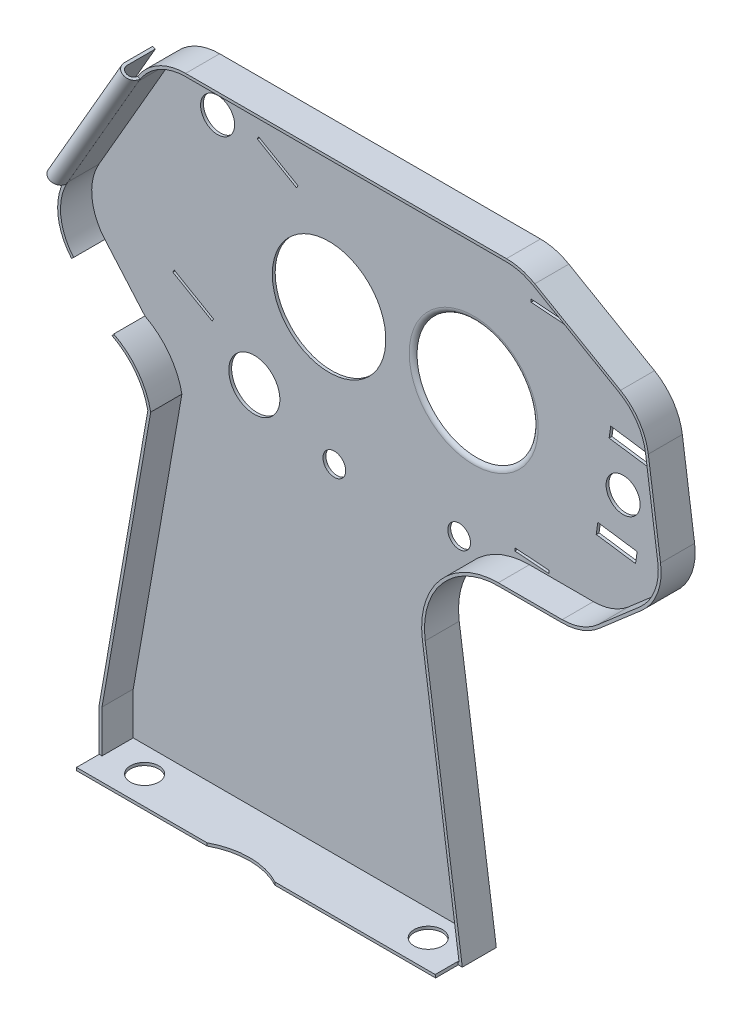
from build123d import *

# Parameters (mm, degrees)
BOSS_EXTRUDE1_DEPTH         = 5
SHELL1_T                    = -0.5
SKETCH4_R                   = 2.5
CUT_EXTRUDE4_DEPTH          = 10
CUT_SWEEP2_START            = 1
CUT_SWEEP2_DEPTH            = 4
SKETCH8_W                   = 6
SKETCH8_H                   = 10.878336181
CUT_EXTRUDE6_DEPTH          = 10
SKETCH11_R                  = 4.5
SKETCH11_R_2                = 10.5
SKETCH11_R_3                = 10
CUT_EXTRUDE7_DEPTH          = 150.877510373
FILLET1_R                   = 1
BOSS_EXTRUDE6_START         = 69.993050043
BOSS_EXTRUDE6_DEPTH         = 26.446393474
BOSS_EXTRUDE6_START_2       = -40
BOSS_EXTRUDE6_2_OUTLINE_W   = 1.69894254
BOSS_EXTRUDE6_2_OUTLINE_H   = 3
BOSS_EXTRUDE6_2_OUTLINE_W_2 = 1.590498846
BOSS_EXTRUDE6_2_OUTLINE_H_2 = 10
BOSS_EXTRUDE6_2_DEPTH       = 7.043773978
BOSS_EXTRUDE6_3_OUTLINE_W   = 1.69894254
BOSS_EXTRUDE6_3_OUTLINE_H   = 7
BOSS_EXTRUDE6_3_DEPTH       = 3.122658049
BOSS_EXTRUDE6_START_3       = -33.015543653
BOSS_EXTRUDE6_4_OUTLINE_W   = 1.590498846
BOSS_EXTRUDE6_4_OUTLINE_H   = 3
BOSS_EXTRUDE6_4_DEPTH       = 2.015543653
SKETCH17_R                  = 3
CUT_EXTRUDE8_DEPTH          = 10
CUT_EXTRUDE9_DEPTH          = 10
SKETCH19_R                  = 2
CUT_EXTRUDE10_DEPTH         = 150.877510373
CUT_EXTRUDE11_DEPTH         = 10


with BuildPart() as part:
    # Sketch1 → Boss-Extrude1 (new, symmetric)
    with BuildSketch(Plane.XY):
        with BuildLine():
            Line((0, 0), (64, 0))
            Line((64, 0), (57.458864255, 46.542599231))
            ThreePointArc((57.458864255, 46.542599231), (60.521124606, 56.88061692), (70.332349149, 61.351849543))
            Line((70.332349149, 61.351849543), (81.602015886, 61.351849543))
            ThreePointArc((81.602015886, 61.351849543), (85.0970904, 61.9825137), (88.15132127, 63.794958715))
            Line((88.15132127, 63.794958715), (95.587384775, 70.239547086))
            ThreePointArc((95.587384775, 70.239547086), (98.399557697, 74.280371374), (98.942828678, 79.173369852))
            Line((98.942828678, 79.173369852), (96.783267224, 94.707844854))
            ThreePointArc((96.783267224, 94.707844854), (95.173069343, 98.916646259), (91.878517937, 101.991166954))
            Line((91.878517937, 101.991166954), (76.780291664, 110.708131957))
            ThreePointArc((76.780291664, 110.708131957), (74.368482115, 111.707136182), (71.780291664, 112.047877919))
            Line((71.780291664, 112.047877919), (15.23328628, 112.047877919))
            ThreePointArc((15.23328628, 112.047877919), (10.23328628, 110.708131957), (6.573032242, 107.047877919))
            Line((6.573032242, 107.047877919), (-5.979384502, 85.30645436))
            ThreePointArc((-5.979384502, 85.30645436), (-7.273805779, 79.355434178), (-4.876021292, 73.757148976))
            Line((-4.876021292, 73.757148976), (2.24853328, 65.536509085))
            ThreePointArc((2.24853328, 65.536509085), (6.355355668, 62.120008219), (8.572429973, 57.259653311))
            Line((8.572429973, 57.259653311), (0, 8))
            Line((0, 8), (0, 0))
        make_face()
    extrude(amount=BOSS_EXTRUDE1_DEPTH, both=True)

    # Shell1
    shell1_openings = [part.faces().sort_by_distance(p)[0] for p in [
        (40.493150865, 62.038987827, 5),
    ]]
    offset(amount=SHELL1_T, openings=shell1_openings, kind=Kind.INTERSECTION)

    # Sketch4 → Cut-Extrude4 (cut)
    with BuildSketch(Plane.XZ):
        with Locations(Location((7, 0, 0), (0, 0, 270))):
            Circle(SKETCH4_R)
        with Locations(Location((57, 0, 0), (0, 0, 270))):
            Circle(SKETCH4_R)
        with BuildLine():
            Line((23, 5), (35, 5))
            ThreePointArc((35, 5), (29, 3.5), (23, 5))
        make_face()
    extrude(amount=-CUT_EXTRUDE4_DEPTH, mode=Mode.SUBTRACT)

    # Cut-Sweep2: read off the stored shape, not the designer's step
    # Cut-Sweep2 outline → Cut-Sweep2 (cut)
    with BuildSketch(Plane.XY.offset(CUT_SWEEP2_START)):
        with BuildLine():
            Line((63.222895016, 0.5), (63.293165433, 0))
            Line((63.293165433, 0), (64, 0))
            Line((64, 0), (57.458864255, 46.542599231))
            ThreePointArc((57.458864255, 46.542599231), (60.521124606, 56.88061692), (70.332349149, 61.351849543))
            Line((70.332349149, 61.351849543), (81.602015886, 61.351849543))
            ThreePointArc((81.602015886, 61.351849543), (85.0970904, 61.9825137), (88.15132127, 63.794958715))
            Line((88.15132127, 63.794958715), (95.587384775, 70.239547086))
            ThreePointArc((95.587384775, 70.239547086), (98.399557697, 74.280371374), (98.942828678, 79.173369852))
            Line((98.942828678, 79.173369852), (96.783267224, 94.707844854))
            ThreePointArc((96.783267224, 94.707844854), (95.173069343, 98.916646258), (91.878517937, 101.991166954))
            Line((91.878517937, 101.991166954), (76.780291664, 110.708131957))
            ThreePointArc((76.780291664, 110.708131957), (74.368482115, 111.707136182), (71.780291664, 112.047877919))
            Line((71.780291664, 112.047877919), (15.23328628, 112.047877919))
            ThreePointArc((15.23328628, 112.047877919), (10.23328628, 110.708131957), (6.573032242, 107.047877919))
            Line((6.573032242, 107.047877919), (-5.979384502, 85.30645436))
            ThreePointArc((-5.979384502, 85.30645436), (-7.273805779, 79.355434178), (-4.876021292, 73.757148976))
            Line((-4.876021292, 73.757148976), (2.24853328, 65.536509085))
            ThreePointArc((2.24853328, 65.536509085), (6.355355668, 62.120008219), (8.572429973, 57.259653311))
            Line((8.572429973, 57.259653311), (0, 8))
            Line((0, 8), (0, 0.5))
            Line((0, 0.5), (0.5, 0.5))
            Line((0.5, 0.5), (0.5, 7.956818155))
            Line((0.5, 7.956818155), (9.081153751, 57.266600812))
            ThreePointArc((9.081153751, 57.266600812), (6.811556982, 62.345857113), (2.562843108, 65.937283639))
            Line((2.562843108, 65.937283639), (-4.498176751, 74.084614245))
            ThreePointArc((-4.498176751, 74.084614245), (-6.776072013, 79.402985187), (-5.5463718, 85.05645436))
            Line((-5.5463718, 85.05645436), (7.006044944, 106.797877919))
            ThreePointArc((7.006044944, 106.797877919), (10.48328628, 110.275119255), (15.23328628, 111.547877919))
            Line((15.23328628, 111.547877919), (71.780291664, 111.547877919))
            ThreePointArc((71.780291664, 111.547877919), (74.239072592, 111.224173269), (76.530291664, 110.275119255))
            Line((76.530291664, 110.275119255), (91.628517937, 101.558154252))
            ThreePointArc((91.628517937, 101.558154252), (94.758341773, 98.637359591), (96.28802976, 94.638998257))
            Line((96.28802976, 94.638998257), (98.447591213, 79.104523255))
            ThreePointArc((98.447591213, 79.104523255), (97.931483782, 74.456174701), (95.259919506, 70.617391628))
            Line((95.259919506, 70.617391628), (87.823856001, 64.172803257))
            ThreePointArc((87.823856001, 64.172803257), (84.922336675, 62.450980492), (81.602015886, 61.851849543))
            Line((81.602015886, 61.851849543), (70.332349149, 61.851849543))
            ThreePointArc((70.332349149, 61.851849543), (60.143769816, 57.208646435), (56.963730221, 46.47301268))
            Line((56.963730221, 46.47301268), (63.424815796, 0.5))
            Line((63.424815796, 0.5), (63.222895016, 0.5))
        make_face()
    extrude(amount=CUT_SWEEP2_DEPTH, mode=Mode.SUBTRACT)

    # Sketch8 → Cut-Extrude6 (cut)
    with BuildSketch(Plane(origin=(34.097487332, 29.551155688, 0), x_dir=(0, 0, -1), z_dir=(0.7556890827898172, 0.6549305384178423, 0))):
        with Locations((2, 53.491759419)):
            Rectangle(SKETCH8_W, SKETCH8_H)
    extrude(amount=-CUT_EXTRUDE6_DEPTH, mode=Mode.SUBTRACT)

    # Sketch11 → Cut-Extrude7 (cut, through all)
    with BuildSketch(Plane.XY.offset(5)):
        with Locations(Location((21.843413851, 65.071690598, 0), (0, 0, 180))):
            Circle(SKETCH11_R)
        with Locations(Location((60.516838143, 83.547877919, 0), (0, 0, 180))):
            Circle(SKETCH11_R_2)
        with Locations(Location((35.016838143, 83.547877919, 0), (0, 0, 180))):
            Circle(SKETCH11_R_3)
    extrude(amount=-CUT_EXTRUDE7_DEPTH, mode=Mode.SUBTRACT)

    # Fillet1
    # the kernel refuses this fillet: 1 mm, written as the material it takes off along each edge
    with BuildSketch(Plane(origin=(60.516838143, 83.547877919, -4.5), x_dir=(-1, 0, 0), z_dir=(0, 1, 0))) as fillet1_piece_1:
        with BuildLine():
            CenterArc((11.366025404, -1), FILLET1_R, 90, 60)
            Line((11.366025404, 0), (11.366025404, 0.02))
            Line((11.366025404, 0.02), (10.5, 0.02))
            Line((10.5, 0.02), (10.48, 0))
            ThreePointArc((10.48, 0), (10.48, -0.25), (10.482679492, -0.49))
            Line((10.482679492, -0.49), (10.5, -0.5))
        make_face()
    revolve(axis=Axis((60.516838143, 83.547877919, -4.5), (0, 0, 1)), mode=Mode.SUBTRACT)

    # Boss-Extrude6: read off the stored shape, not the designer's step
    # Boss-Extrude6 outline → Boss-Extrude6 (add)
    with BuildSketch(Plane(origin=(0, 0, 0), x_dir=(0.8660254037844399, -0.4999999999999979, 0), z_dir=(0.4999999999999979, 0.8660254037844398, 0)).offset(BOSS_EXTRUDE6_START)):
        with BuildLine():
            add(Edge.make_bspline(
                [(-47.337092239, -1), (-47.337092239, -2.5), (-48.820393697, -2.5), (-50.303695156, -2.5), (-50.303695156, -1)],
                knots=[0, 0, 0, 1.570796327, 1.570796327, 3.141592654, 3.141592654, 3.141592654], degree=2, weights=[1, 0.707106781, 1, 0.707106781, 1]))
            Line((-47.337092239, -1), (-47.831526058, -1))
            add(Edge.make_bspline(
                [(-47.831526058, -1), (-47.831526058, -2), (-48.820393697, -2), (-49.809261336, -2), (-49.809261336, -1)],
                knots=[0, 0, 0, 1.570796327, 1.570796327, 3.141592654, 3.141592654, 3.141592654], degree=2, weights=[1, 0.707106781, 1, 0.707106781, 1]))
            Line((-49.809261336, -1), (-49.809261336, 4))
            Line((-49.809261336, 4), (-50.303695156, 4))
            Line((-50.303695156, 4), (-50.303695156, -1))
        make_face()
    extrude(amount=BOSS_EXTRUDE6_DEPTH)

    # Boss-Extrude6 2 outline → Boss-Extrude6 2 (cut)
    with BuildSketch(Plane(origin=(0, 0, 0), x_dir=(0.365571123575949, 0.9307834085368187, 0), z_dir=(0.9307834085368187, -0.36557112357594895, 0)).offset(BOSS_EXTRUDE6_START_2)):
        with Locations((75.84947127, 2.5)):
            Rectangle(BOSS_EXTRUDE6_2_OUTLINE_W, BOSS_EXTRUDE6_2_OUTLINE_H)
        with Locations((103.204750577, -1)):
            Rectangle(BOSS_EXTRUDE6_2_OUTLINE_W_2, BOSS_EXTRUDE6_2_OUTLINE_H_2)
    extrude(amount=BOSS_EXTRUDE6_2_DEPTH, mode=Mode.SUBTRACT)

    # Boss-Extrude6 3 outline → Boss-Extrude6 3 (cut)
    with BuildSketch(Plane(origin=(0, 0, 0), x_dir=(0.365571123575949, 0.9307834085368187, 0), z_dir=(0.9307834085368187, -0.36557112357594895, 0)).offset(BOSS_EXTRUDE6_START_2)):
        with Locations((75.84947127, -2.5)):
            Rectangle(BOSS_EXTRUDE6_3_OUTLINE_W, BOSS_EXTRUDE6_3_OUTLINE_H)
    extrude(amount=BOSS_EXTRUDE6_3_DEPTH, mode=Mode.SUBTRACT)

    # Boss-Extrude6 4 outline → Boss-Extrude6 4 (cut)
    with BuildSketch(Plane(origin=(0, 0, 0), x_dir=(0.365571123575949, 0.9307834085368187, 0), z_dir=(0.9307834085368187, -0.36557112357594895, 0)).offset(BOSS_EXTRUDE6_START_3)):
        with Locations((103.204750577, 2.5)):
            Rectangle(BOSS_EXTRUDE6_4_OUTLINE_W, BOSS_EXTRUDE6_4_OUTLINE_H)
    extrude(amount=BOSS_EXTRUDE6_4_DEPTH, mode=Mode.SUBTRACT)

    # Sketch17 → Cut-Extrude8 (cut)
    with BuildSketch(Plane(origin=(0, 0, -5), x_dir=(-1, 0, 0), z_dir=(0, 0, -1))):
        with Locations((-86.847845229, 80.771032583)):
            Circle(SKETCH17_R)
        with Locations((-15.370383265, 103.018842591)):
            Circle(SKETCH17_R)
    extrude(amount=-CUT_EXTRUDE8_DEPTH, mode=Mode.SUBTRACT)

    # Sketch18 → Cut-Extrude9 (cut)
    with BuildSketch(Plane.XY.offset(-4.5)):
        Polygon((67.794990984, 63.159599672), (67.758803504, 62.660910926), (73.743068466, 62.226661163), (73.779255946, 62.72534991), align=None)
        Polygon((76.601879403, 101.623072167), (76.638066884, 102.121760914), (70.653801921, 102.556010677), (70.617614441, 102.05732193), align=None)
        Polygon((22.614883225, 103.298241446), (22.364883225, 102.865228744), (29.293086455, 98.865228744), (29.543086455, 99.298241446), align=None)
        Polygon((14.659111859, 71.518441227), (7.730908628, 75.518441227), (7.480908628, 75.085428525), (14.409111859, 71.085428525), align=None)
    extrude(amount=-CUT_EXTRUDE9_DEPTH, mode=Mode.SUBTRACT)

    # Sketch19 → Cut-Extrude10 (cut, through all)
    with BuildSketch(Plane(origin=(0, 0, -5), x_dir=(-1, 0, 0), z_dir=(0, 0, -1))):
        with Locations((-57.950079932, 60)):
            Circle(SKETCH19_R)
        with Locations((-35.950079932, 60)):
            Circle(SKETCH19_R)
    extrude(amount=-CUT_EXTRUDE10_DEPTH, mode=Mode.SUBTRACT)

    # Sketch20 → Cut-Extrude11 (cut)
    with BuildSketch(Plane(origin=(0, 0, -5), x_dir=(-1, 0, 0), z_dir=(0, 0, -1))):
        Polygon((-91.592738232, 89.181501678), (-91.308182839, 87.201848115), (-84.379395369, 88.19779199), (-84.663950762, 90.177445553), align=None)
        Polygon((-89.316295089, 73.344273176), (-89.031739697, 71.364619614), (-82.102952227, 72.360563488), (-82.38750762, 74.340217051), align=None)
    extrude(amount=-CUT_EXTRUDE11_DEPTH, mode=Mode.SUBTRACT)


solid = part.part
